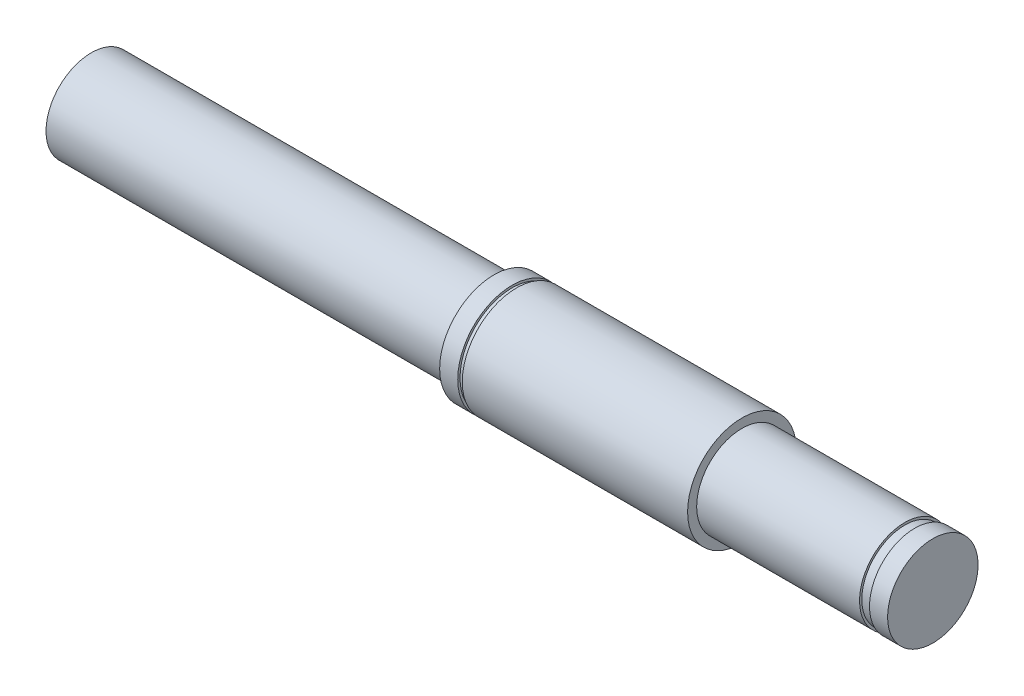
from build123d import *

# Parameters (mm, degrees)
SCALE1_SCALE = 0.317565217


with BuildPart() as part:
    # Sketch7 → Revolve1 (revolve)
    with BuildSketch(Plane.XY):
        Polygon((-2, 5), (-2, 6), (0, 6), (0, 5.749556412), (0.5, 5.749556412), (0.5, 6), (25.4, 6), (25.4, 5), (43.4, 5), (43.4, 4.75), (44.5, 4.75), (44.5, 5), (46.5, 5), (46.5, 0), (-46.5, 0), (-46.5, 5), align=None)
    revolve(axis=Axis((0, 0, 0), (1, 0, 0)))


with BuildPart() as part_1:
    # Scale1: scaled about (1.299713815, 0, 0)
    add(part.part.scale(SCALE1_SCALE).moved(Location((0.886969915, 0, 0))))


solid = part_1.part
